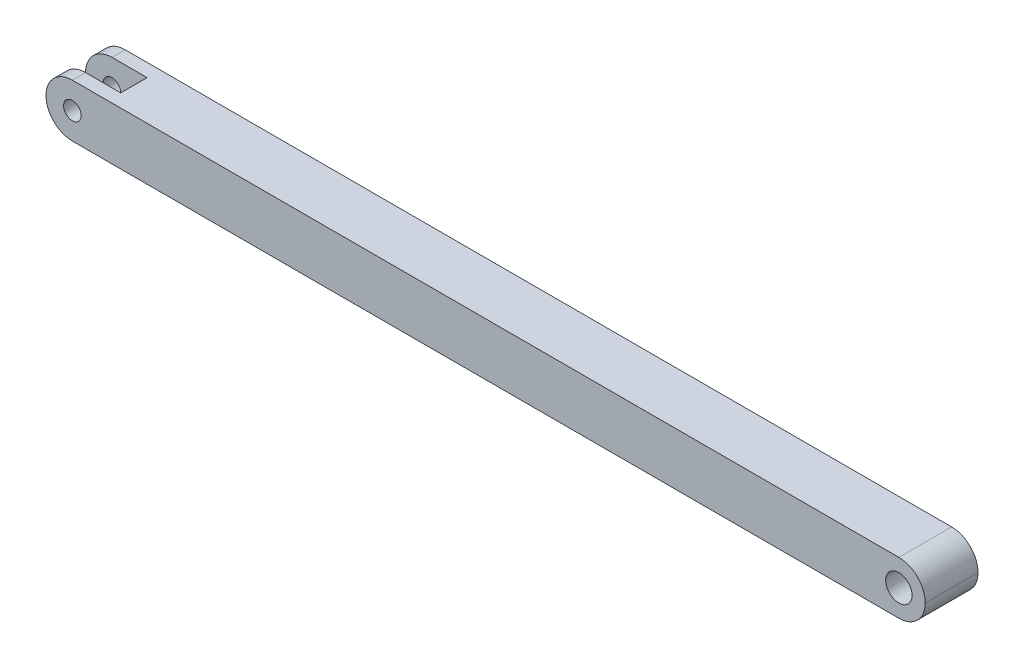
from build123d import *

# Parameters (mm, degrees)
SKETCH1_W               = 500
SKETCH1_H               = 30
BOSS_EXTRUDE1_DEPTH     = 15
CUT_EXTRUDE1_REACH      = 503.124
SKETCH2_W               = 35
SKETCH2_H               = 15
CUT_EXTRUDE2_DEPTH      = 502.796771612
CUT_EXTRUDE2_DEPTH_BACK = 502.796771612
SKETCH3_R               = 5
SKETCH3_R_2             = 7.5
FILLET3_R               = 15


with BuildPart() as part:
    # Sketch1 → Boss-Extrude1 (new, symmetric)
    with BuildSketch(Plane.XY):
        with Locations((250, 15)):
            Rectangle(SKETCH1_W, SKETCH1_H)
    extrude(amount=BOSS_EXTRUDE1_DEPTH, both=True)

    # Sketch2 → Cut-Extrude1 (cut, up to next)
    with BuildSketch(Plane(origin=(0, 30, 0), x_dir=(1, 0, 0), z_dir=(0, 1, 0)), mode=Mode.PRIVATE) as cut_extrude1_sk1:
        with Locations((17.5, 0)):
            Rectangle(SKETCH2_W, SKETCH2_H)
    cut_extrude1_tool1 = extrude(cut_extrude1_sk1.sketch, amount=-CUT_EXTRUDE1_REACH, mode=Mode.PRIVATE) & part.part
    add(cut_extrude1_tool1.solids().sort_by_distance((17.5, 30, 0))[0], mode=Mode.SUBTRACT)

    # Sketch3 → Cut-Extrude2 (cut, two sides: drawn at the far end of the back side and taken through both)
    with BuildSketch(Plane.XY.offset(15).offset(-CUT_EXTRUDE2_DEPTH_BACK)):
        with Locations((15, 15)):
            Circle(SKETCH3_R)
        with Locations((485, 15)):
            Circle(SKETCH3_R_2)
    extrude(amount=CUT_EXTRUDE2_DEPTH + CUT_EXTRUDE2_DEPTH_BACK, mode=Mode.SUBTRACT)

    # Fillet3
    fillet3_edges = [part.edges().sort_by_distance(p)[0] for p in [
        (500, 0, 0),
        (500, 30, 0),
        (0, 0, 11.25),
        (0, 0, -11.25),
        (0, 30, -11.25),
        (0, 30, 11.25),
    ]]
    fillet(fillet3_edges, radius=FILLET3_R - 0.0001)  # a hair under: the kernel refuses the full size


solid = part.part
